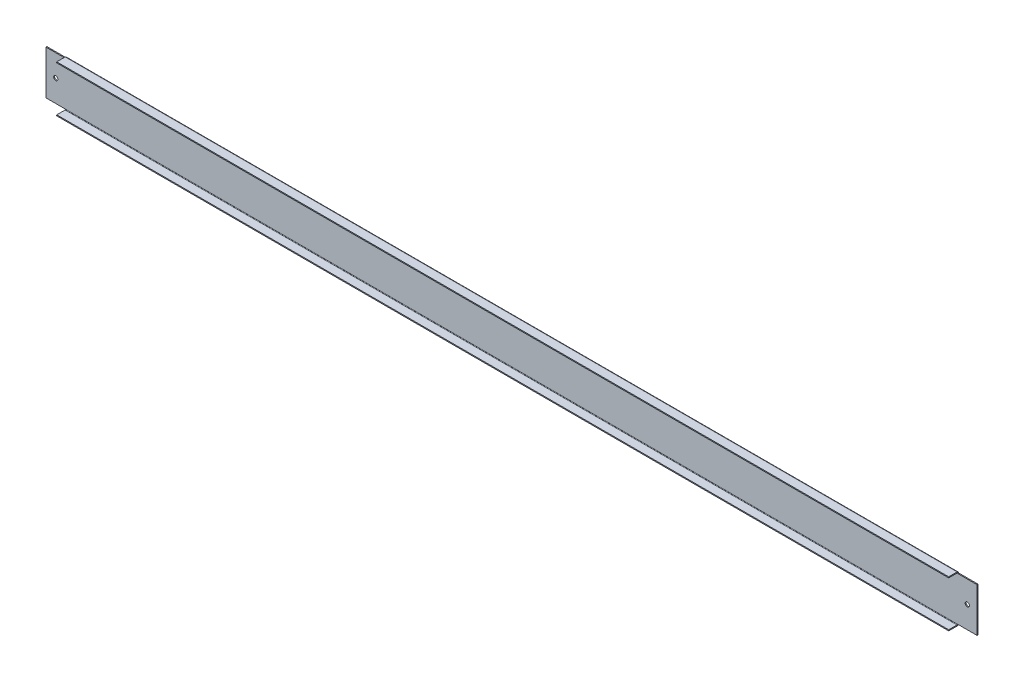
from build123d import *

# Parameters (mm, degrees)
SKETCH1_W                    = 1430
SKETCH1_H                    = 72
BASE_FLANGE1_DEPTH           = 1.5
EDGE_FLANGE1_STRIP_W         = 7.4732
EDGE_FLANGE1_STRIP_H         = 1.5
EDGE_FLANGE1_STRIP_CUT_DEPTH = 1430
EDGE_FLANGE1_DEPTH           = 1430
EDGE_FLANGE2_STRIP_W         = 7.4732
EDGE_FLANGE2_STRIP_H         = 1.5
EDGE_FLANGE2_STRIP_CUT_DEPTH = 1430
EDGE_FLANGE2_DEPTH           = 1430
CUT_EXTRUDE1_START           = -912.816666667
CUT_EXTRUDE1_DEPTH           = 30
CUT_EXTRUDE2_START           = 487.183333333
CUT_EXTRUDE2_DEPTH           = 30
SKETCH14_R                   = 3.25
CUT_EXTRUDE3_DEPTH           = 10


# Read off the part's stored shape, not the designer's step: Cut-Extrude1, Cut-Extrude2
# Sheet-metal steps are written as plain solids
with BuildPart() as part:
    # Sketch1 → Base-Flange1 (new body)
    with BuildSketch(Plane.XY):
        with Locations((-197.816666667, 186.841666667)):
            Rectangle(SKETCH1_W, SKETCH1_H)
    extrude(amount=-BASE_FLANGE1_DEPTH)

    # Edge-Flange1 strip (across the edge) → Edge-Flange1 strip cut (cut)
    with BuildSketch(Plane(origin=(517.183333333, 222.841666667, 0), x_dir=(0, -1, 0), z_dir=(-1, 0, 0))):
        with Locations((-1.5, -0.75)):
            Rectangle(EDGE_FLANGE1_STRIP_W, EDGE_FLANGE1_STRIP_H)
    extrude(amount=EDGE_FLANGE1_STRIP_CUT_DEPTH, mode=Mode.SUBTRACT)

    # Edge-Flange1 section (across the edge) → Edge-Flange1 (add)
    with BuildSketch(Plane(origin=(517.183333333, 222.841666667, 0), x_dir=(0, -1, 0), z_dir=(-1, 0, 0))):
        with BuildLine():
            Line((0, 0.7366), (0, 13.5))
            Line((0, 13.5), (1.5, 13.5))
            Line((1.5, 13.5), (1.5, 0.7366))
            ThreePointArc((1.5, 0.7366), (1.715745145, 0.215745145), (2.2366, 0))
            Line((2.2366, 0), (2.2366, -1.5))
            ThreePointArc((2.2366, -1.5), (0.655084973, -0.844915027), (0, 0.7366))
        make_face()
    extrude(amount=EDGE_FLANGE1_DEPTH)

    # Edge-Flange2 strip (across the edge) → Edge-Flange2 strip cut (cut)
    with BuildSketch(Plane(origin=(-912.816666667, 150.841666667, 0), x_dir=(0, 1, 0), z_dir=(1, 0, 0))):
        with Locations((-1.5, -0.75)):
            Rectangle(EDGE_FLANGE2_STRIP_W, EDGE_FLANGE2_STRIP_H)
    extrude(amount=EDGE_FLANGE2_STRIP_CUT_DEPTH, mode=Mode.SUBTRACT)

    # Edge-Flange2 section (across the edge) → Edge-Flange2 (add)
    with BuildSketch(Plane(origin=(-912.816666667, 150.841666667, 0), x_dir=(0, 1, 0), z_dir=(1, 0, 0))):
        with BuildLine():
            Line((0, 0.7366), (0, 13.5))
            Line((0, 13.5), (1.5, 13.5))
            Line((1.5, 13.5), (1.5, 0.7366))
            ThreePointArc((1.5, 0.7366), (1.715745145, 0.215745145), (2.2366, 0))
            Line((2.2366, 0), (2.2366, -1.5))
            ThreePointArc((2.2366, -1.5), (0.655084973, -0.844915027), (0, 0.7366))
        make_face()
    extrude(amount=EDGE_FLANGE2_DEPTH)

    # Cut-Extrude1 outline → Cut-Extrude1 (cut)
    with BuildSketch(Plane.YZ.offset(CUT_EXTRUDE1_START)):
        with BuildLine():
            ThreePointArc((150.841666667, 0.7366), (151.49675164, -0.844915027), (153.078266667, -1.5))
            Line((153.078266667, -1.5), (153.078266667, 0))
            ThreePointArc((153.078266667, 0), (152.557411812, 0.215745145), (152.341666667, 0.7366))
            Line((152.341666667, 0.7366), (152.341666667, 13.5))
            Line((152.341666667, 13.5), (150.841666667, 13.5))
            Line((150.841666667, 13.5), (150.841666667, 0.7366))
        make_face()
        with BuildLine():
            ThreePointArc((221.341666667, 0.7366), (221.125921522, 0.215745145), (220.605066667, 0))
            Line((220.605066667, 0), (220.605066667, -1.5))
            ThreePointArc((220.605066667, -1.5), (222.186581693, -0.844915026), (222.841666667, 0.7366))
            Line((222.841666667, 0.7366), (222.841666667, 13.5))
            Line((222.841666667, 13.5), (221.341666667, 13.5))
            Line((221.341666667, 13.5), (221.341666667, 0.7366))
        make_face()
    extrude(amount=CUT_EXTRUDE1_DEPTH, mode=Mode.SUBTRACT)

    # Cut-Extrude2 outline → Cut-Extrude2 (cut)
    with BuildSketch(Plane.YZ.offset(CUT_EXTRUDE2_START)):
        with BuildLine():
            ThreePointArc((150.841666667, 0.7366), (151.49675164, -0.844915027), (153.078266667, -1.5))
            Line((153.078266667, -1.5), (153.078266667, 0))
            ThreePointArc((153.078266667, 0), (152.557411812, 0.215745145), (152.341666667, 0.7366))
            Line((152.341666667, 0.7366), (152.341666667, 13.5))
            Line((152.341666667, 13.5), (150.841666667, 13.5))
            Line((150.841666667, 13.5), (150.841666667, 0.7366))
        make_face()
        with BuildLine():
            ThreePointArc((221.341666667, 0.7366), (221.125921522, 0.215745145), (220.605066667, 0))
            Line((220.605066667, 0), (220.605066667, -1.5))
            ThreePointArc((220.605066667, -1.5), (222.186581693, -0.844915026), (222.841666667, 0.7366))
            Line((222.841666667, 0.7366), (222.841666667, 13.5))
            Line((222.841666667, 13.5), (221.341666667, 13.5))
            Line((221.341666667, 13.5), (221.341666667, 0.7366))
        make_face()
    extrude(amount=CUT_EXTRUDE2_DEPTH, mode=Mode.SUBTRACT)

    # Sketch14 → Cut-Extrude3 (cut)
    with BuildSketch(Plane.XY):
        with Locations((502.183333333, 186.841666667)):
            Circle(SKETCH14_R)
        with Locations((-897.816666667, 186.841666667)):
            Circle(SKETCH14_R)
    extrude(amount=-CUT_EXTRUDE3_DEPTH, mode=Mode.SUBTRACT)


solid = part.part
